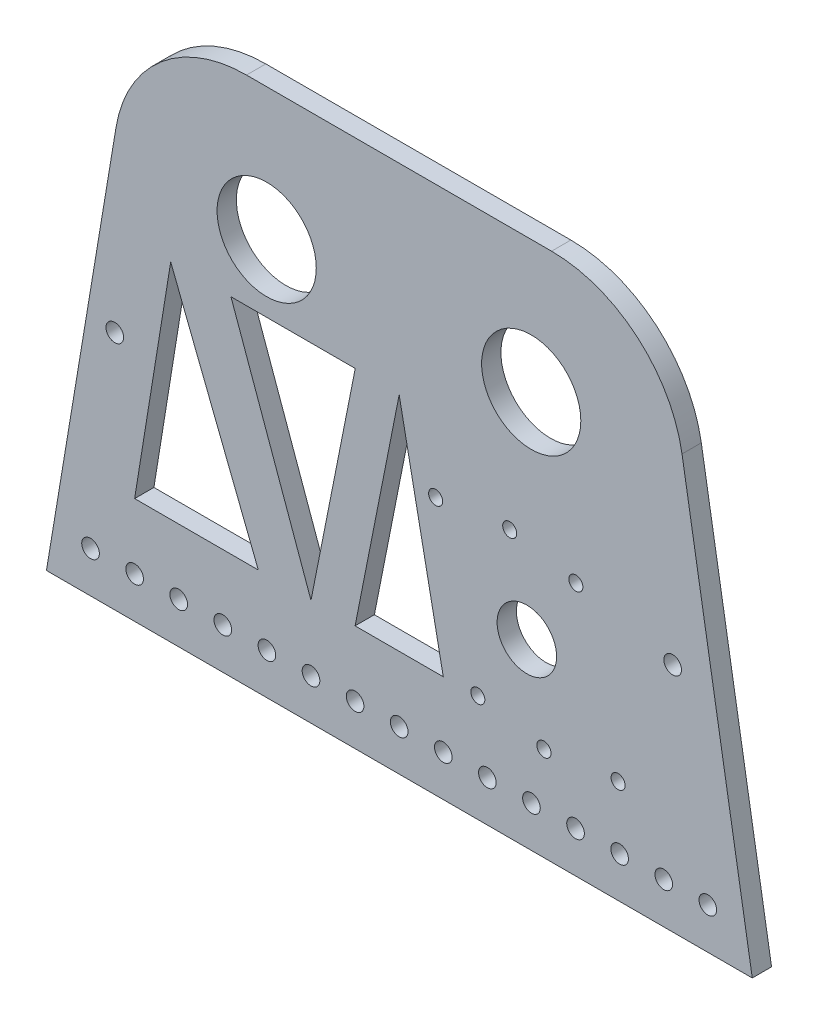
from build123d import *

# Parameters (mm, degrees)
SKETCH2_R           = 14.2875
SKETCH2_R_2         = 2.54
SKETCH2_R_3         = 2.0193
SKETCH2_R_4         = 2.042883772
SKETCH2_R_5         = 8.570756391
BOSS_EXTRUDE1_DEPTH = 5.55625
FILLET1_R           = 38.1


with BuildPart() as part:
    # Sketch2 → Boss-Extrude1 (new body)
    with BuildSketch(Plane.XY):
        Polygon((-33.221954044, -123.033671084), (-58.55568732, -123.033671084), (-33.221954044, 29.366328916), (119.178045956, 29.366328916), (144.745882617, -123.033671084), (119.178045956, -123.033671084), align=None)
        with Locations((4.878045956, -8.733671084)):
            Circle(SKETCH2_R, mode=Mode.SUBTRACT)
        with Locations((81.078045956, -8.733671084)):
            Circle(SKETCH2_R, mode=Mode.SUBTRACT)
        with Locations((-45.85568732, -111.187710863)):
            Circle(SKETCH2_R_2, mode=Mode.SUBTRACT)
        with Locations((-33.15568732, -111.187710863)):
            Circle(SKETCH2_R_2, mode=Mode.SUBTRACT)
        with Locations((-20.45568732, -111.187710863)):
            Circle(SKETCH2_R_2, mode=Mode.SUBTRACT)
        with Locations((-7.75568732, -111.187710863)):
            Circle(SKETCH2_R_2, mode=Mode.SUBTRACT)
        with Locations((4.94431268, -111.187710863)):
            Circle(SKETCH2_R_2, mode=Mode.SUBTRACT)
        with Locations((17.64431268, -111.187710863)):
            Circle(SKETCH2_R_2, mode=Mode.SUBTRACT)
        with Locations((30.34431268, -111.187710863)):
            Circle(SKETCH2_R_2, mode=Mode.SUBTRACT)
        with Locations((43.04431268, -111.187710863)):
            Circle(SKETCH2_R_2, mode=Mode.SUBTRACT)
        with Locations((55.74431268, -111.187710863)):
            Circle(SKETCH2_R_2, mode=Mode.SUBTRACT)
        with Locations((68.44431268, -111.187710863)):
            Circle(SKETCH2_R_2, mode=Mode.SUBTRACT)
        with Locations((81.14431268, -111.187710863)):
            Circle(SKETCH2_R_2, mode=Mode.SUBTRACT)
        with Locations((93.84431268, -111.187710863)):
            Circle(SKETCH2_R_2, mode=Mode.SUBTRACT)
        with Locations((106.54431268, -111.187710863)):
            Circle(SKETCH2_R_2, mode=Mode.SUBTRACT)
        with Locations((119.24431268, -111.187710863)):
            Circle(SKETCH2_R_2, mode=Mode.SUBTRACT)
        with Locations((131.94431268, -111.187710863)):
            Circle(SKETCH2_R_2, mode=Mode.SUBTRACT)
        with Locations((106.095114392, -93.347839884)):
            Circle(SKETCH2_R_3, mode=Mode.SUBTRACT)
        with Locations((53.54416169, -48.740086568)):
            Circle(SKETCH2_R_3, mode=Mode.SUBTRACT)
        with Locations((84.742777137, -95.968518796)):
            Circle(SKETCH2_R_4, mode=Mode.SUBTRACT)
        with Locations((65.698830527, -92.157058574)):
            Circle(SKETCH2_R_3, mode=Mode.SUBTRACT)
        with Locations((74.875343897, -46.129831585)):
            Circle(SKETCH2_R_3, mode=Mode.SUBTRACT)
        with Locations((93.940445554, -49.930867878)):
            Circle(SKETCH2_R_3, mode=Mode.SUBTRACT)
        with Locations((79.818772789, -71.039603253)):
            Circle(SKETCH2_R_5, mode=Mode.SUBTRACT)
        with Locations((-38.864770805, -53.818383955)):
            Circle(SKETCH2_R_2, mode=Mode.SUBTRACT)
        with Locations((121.819927098, -56.358383955)):
            Circle(SKETCH2_R_2, mode=Mode.SUBTRACT)
        Polygon((-22.767796965, -28.16783361), (-33.15568732, -92.394571291), (2.468038836, -92.394571291), align=None, mode=Mode.SUBTRACT)
        Polygon((43.04431268, -28.399699089), (55.74431268, -92.394571291), (30.34431268, -92.394571291), align=None, mode=Mode.SUBTRACT)
        Polygon((17.64431268, -92.394571291), (30.390327173, -28.16783361), (-5.41538745, -28.16783361), align=None, mode=Mode.SUBTRACT)
    extrude(amount=BOSS_EXTRUDE1_DEPTH)

    # Fillet1
    fillet1_edges = [part.edges().sort_by_distance(p)[0] for p in [
        (-33.221954044, 29.366328916, 2.778125),
        (119.178045956, 29.366328916, 2.778125),
    ]]
    fillet(fillet1_edges, radius=FILLET1_R)


solid = part.part
